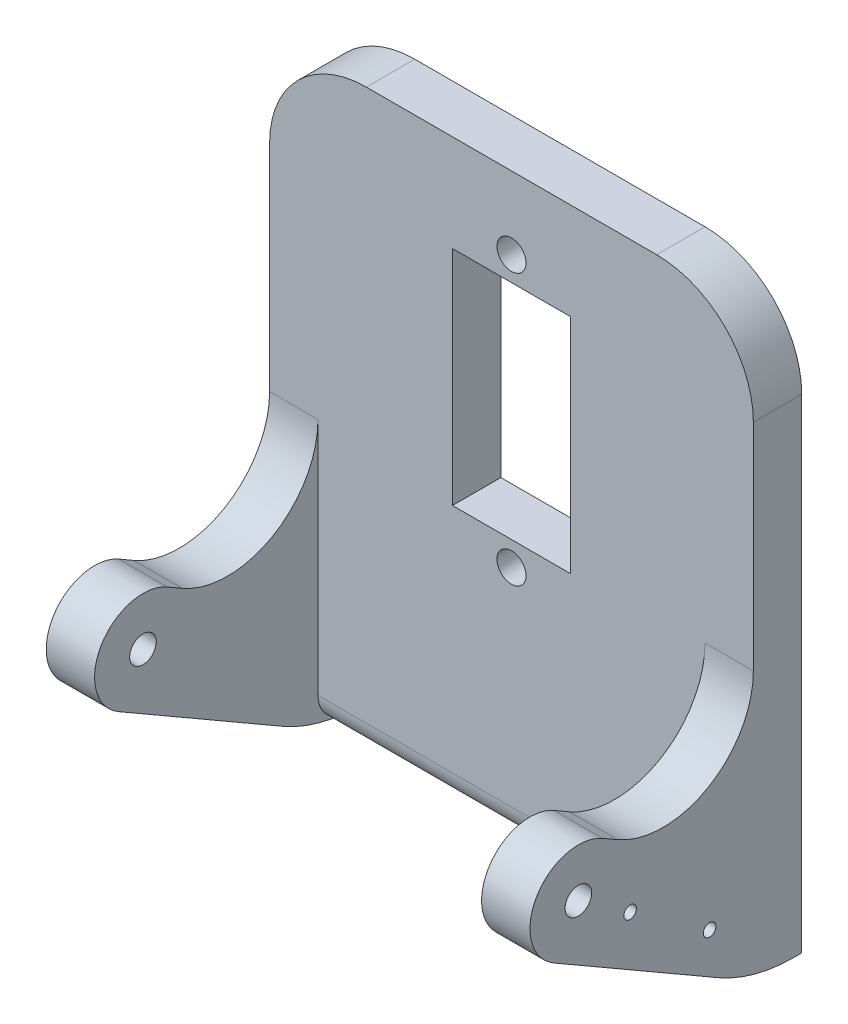
from build123d import *

# Parameters (mm, degrees)
ESQUISSE1_W                  = 50
ESQUISSE1_H                  = 60
BOSS_EXTRU_1_DEPTH           = 5
ESQUISSE2_W                  = 12.2
ESQUISSE2_H                  = 23
ENL_V_MAT_EXTRU_1_DEPTH      = 40.37003937
ESQUISSE3_R                  = 1.5
ENL_V_MAT_EXTRU_2_DEPTH      = 40.37003937
BOSS_EXTRU_2_DEPTH           = 5
CONG_1_RADIUS                = 5
CONG_1_LENGTH                = 5
CONG_2_R                     = 9.35
ENL_V_MAT_EXTRU_3_DEPTH      = 2
ESQUISSE6_R                  = 0.65
ESQUISSE6_R_2                = 1.375
ENL_V_MAT_EXTRU_4_DEPTH      = 61.942279509
CONG_1_OF_SYM_TRIE1_2_RADIUS = 5
CONG_1_OF_SYM_TRIE1_2_LENGTH = 5
CONG_2_OF_SYM_TRIE1_R        = 9.35
ESQUISSE7_R                  = 1.375
ENL_V_MAT_EXTRU_5_DEPTH      = 65.722186549
CONG_3_R                     = 15.5
CONG_4_R                     = 3
CONG_5_R                     = 10


with BuildPart() as part:
    # Esquisse1 → Boss.-Extru.1 (new body)
    with BuildSketch(Plane.XY):
        Rectangle(ESQUISSE1_W, ESQUISSE1_H)
    extrude(amount=BOSS_EXTRU_1_DEPTH)

    # Esquisse2 → Enlèv. mat.-Extru.1 (cut, through all)
    with BuildSketch(Plane.XY.offset(5)):
        with Locations((0, 8.5)):
            Rectangle(ESQUISSE2_W, ESQUISSE2_H)
    extrude(amount=-ENL_V_MAT_EXTRU_1_DEPTH, mode=Mode.SUBTRACT)

    # Esquisse3 → Enlèv. mat.-Extru.2 (cut, through all)
    with BuildSketch(Plane(origin=(0, 0, 0), x_dir=(-1, 0, 0), z_dir=(0, 0, -1))):
        with Locations((0, -5.5)):
            Circle(ESQUISSE3_R)
        with Locations((0, 22.5)):
            Circle(ESQUISSE3_R)
    extrude(amount=-ENL_V_MAT_EXTRU_2_DEPTH, mode=Mode.SUBTRACT)

    # Esquisse4 → Boss.-Extru.2 (add)
    with BuildSketch(Plane(origin=(25, 0, 0), x_dir=(0, 0, -1), z_dir=(1, 0, 0))):
        Polygon((-5, -30), (-29.918584287, -15.613248654), (-24.918584287, -6.952994616), (-5, -18.452994616), align=None)
    boss_extru_2 = extrude(amount=-BOSS_EXTRU_2_DEPTH)

    # Congé1: full round fillet: the end face becomes a half cylinder, R = half its width
    cong_1_face = Plane((22.5, -11.283121635, 27.418584287), x_dir=(1, 0, 0), z_dir=(0, 0.5, 0.866025403784))  # on the end face: x along it, z out of the body
    cong_1_slab = cong_1_face.offset(-CONG_1_RADIUS / 2) * Box(CONG_1_LENGTH, 2 * CONG_1_RADIUS, CONG_1_RADIUS, mode=Mode.PRIVATE)  # the body's end, R deep
    cong_1_round = Plane((22.5, -13.783121635, 23.088457268), x_dir=(0, 0.5, 0.866025403784), z_dir=(1, 0, 0)) * Cylinder(CONG_1_RADIUS, CONG_1_LENGTH, mode=Mode.PRIVATE)  # its axis R under the face
    add(cong_1_slab - cong_1_round, mode=Mode.SUBTRACT)

    # Congé2
    cong_2_edges = [part.edges().sort_by_distance(p)[0] for p in [
        (22.5, -18.452994616, 5),
    ]]
    fillet(cong_2_edges, radius=CONG_2_R)

    # Esquisse5 → Enlèv. mat.-Extru.3 (cut)
    with BuildSketch(Plane.ZY.offset(-20)):
        with BuildLine():
            Line((10.742191848, -24.653283165), (24.350818961, -16.858928401))
            ThreePointArc((24.350818961, -16.858928401), (25.938192754, -12.070476908), (20.964861107, -11.224902792))
            Line((20.964861107, -11.224902792), (8.56647232, -21.51689595))
            ThreePointArc((8.56647232, -21.51689595), (8.216016866, -24.082852363), (10.742191848, -24.653283165))
        make_face()
    extrude(amount=-ENL_V_MAT_EXTRU_3_DEPTH, mode=Mode.SUBTRACT)

    # Esquisse6 → Enlèv. mat.-Extru.4 (cut, through all)
    with BuildSketch(Plane.ZY.offset(-20)):
        with Locations((9.522873524, -23.175934722)):
            Circle(ESQUISSE6_R)
        with Locations((17.74443943, -17.48332073)):
            Circle(ESQUISSE6_R)
        with Locations((23.088457268, -13.783121635)):
            Circle(ESQUISSE6_R_2)
    extrude(amount=-ENL_V_MAT_EXTRU_4_DEPTH, mode=Mode.SUBTRACT)

    # Symétrie1: Boss.-Extru.2 across plane
    add(boss_extru_2.mirror(Plane(origin=(0, 0, 0), x_dir=(0, 0, 1), z_dir=(1, 0, 0))))

    # Congé1 of Sym_trie1 2: full round fillet: the end face becomes a half cylinder, R = half its width
    cong_1_of_sym_trie1_2_face = Plane((-22.5, -11.283121635, 27.418584287), x_dir=(-1, 0, 0), z_dir=(0, 0.5, 0.866025403784))  # on the end face: x along it, z out of the body
    cong_1_of_sym_trie1_2_slab = cong_1_of_sym_trie1_2_face.offset(-CONG_1_OF_SYM_TRIE1_2_RADIUS / 2) * Box(CONG_1_OF_SYM_TRIE1_2_LENGTH, 2 * CONG_1_OF_SYM_TRIE1_2_RADIUS, CONG_1_OF_SYM_TRIE1_2_RADIUS, mode=Mode.PRIVATE)  # the body's end, R deep
    cong_1_of_sym_trie1_2_round = Plane((-22.5, -13.783121635, 23.088457268), x_dir=(0, 0.5, 0.866025403784), z_dir=(-1, 0, 0)) * Cylinder(CONG_1_OF_SYM_TRIE1_2_RADIUS, CONG_1_OF_SYM_TRIE1_2_LENGTH, mode=Mode.PRIVATE)  # its axis R under the face
    add(cong_1_of_sym_trie1_2_slab - cong_1_of_sym_trie1_2_round, mode=Mode.SUBTRACT)

    # Congé2 of Symétrie1
    cong_2_of_sym_trie1_edges = [part.edges().sort_by_distance(p)[0] for p in [
        (-22.5, -18.452994616, 5),
    ]]
    fillet(cong_2_of_sym_trie1_edges, radius=CONG_2_OF_SYM_TRIE1_R)

    # Esquisse7 → Enlèv. mat.-Extru.5 (cut, through all)
    with BuildSketch(Plane.ZY.offset(25)):
        with Locations((23.088457268, -13.783121635)):
            Circle(ESQUISSE7_R)
    extrude(amount=-ENL_V_MAT_EXTRU_5_DEPTH, mode=Mode.SUBTRACT)

    # Congé3
    # the kernel refuses this fillet: 15.5 mm, written as the material it takes off along each edge
    with BuildSketch(Plane(origin=(4.919274896, -30, 5), x_dir=(0, 0, -1), z_dir=(-1, 0, 0)), Plane(origin=(49.919274896, -30, 5), x_dir=(0, 0, -1), z_dir=(-1, 0, 0))) as cong_3_piece_1:
        with BuildLine():
            CenterArc((CONG_3_R * 0.267949192431, -CONG_3_R), CONG_3_R, 90, 30)
            Line((-CONG_3_R * 0.232050807569, -CONG_3_R * 0.133974596216), (-CONG_3_R * 0.242050807569, -CONG_3_R * 0.11665408814))
            Line((-CONG_3_R * 0.242050807569, -CONG_3_R * 0.11665408814), (-CONG_3_R * 0.00535898384862, CONG_3_R * 0.02))
            Line((-CONG_3_R * 0.00535898384862, CONG_3_R * 0.02), (CONG_3_R * 0.267949192431, CONG_3_R * 0.02))
            Line((CONG_3_R * 0.267949192431, CONG_3_R * 0.02), (CONG_3_R * 0.267949192431, 0))
        make_face()
    extrude(amount=54.838549792, mode=Mode.SUBTRACT)

    # Congé4
    cong_4_edges = [part.edges().sort_by_distance(p)[0] for p in [
        (0, -29.433212182, 5),
    ]]
    fillet(cong_4_edges, radius=CONG_4_R)

    # Congé5
    cong_5_edges = [part.edges().sort_by_distance(p)[0] for p in [
        (-25, 30, 2.5),
        (25, 30, 2.5),
    ]]
    fillet(cong_5_edges, radius=CONG_5_R)


solid = part.part
